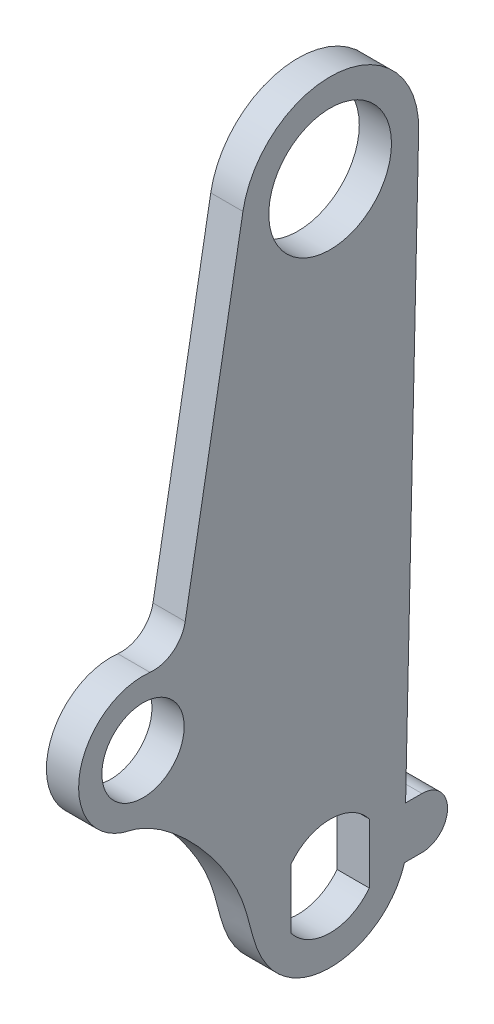
from build123d import *

# Parameters (mm, degrees)
SKETCH1_R           = 4.8387
SKETCH1_R_2         = 3.24612
BOSS_EXTRUDE1_DEPTH = 2.54


with BuildPart() as part:
    # Sketch1 → Boss-Extrude1 (new body)
    with BuildSketch(Plane(origin=(0, 0, 0), x_dir=(0, 0, -1), z_dir=(1, 0, 0))):
        with BuildLine():
            Line((-6.878073538, 1.21750951), (-11.434004928, -24.520302697))
            ThreePointArc((-11.434004928, -24.520302697), (-12.410981202, -26.109465927), (-14.210062649, -26.602647798))
            ThreePointArc((-14.210062649, -26.602647798), (-19.774345123, -30.839061635), (-15.835302692, -36.617676206))
            add(Edge.make_bspline(
                [(-15.835302692, -36.617676206), (-12.794390215, -37.276318003), (-7.085234202, -43.306604459), (-4.978743357, -56.012577764), (4.31920781, -54.832062568), (5.860778025, -49.6443)],
                knots=[0, 0, 0, 0, 0.291844795, 0.391844795, 1, 1, 1, 1], degree=3))
            Line((5.860778025, -49.6443), (7.24445656, -49.6443))
            ThreePointArc((7.24445656, -49.6443), (9.26375656, -47.625), (7.24445656, -45.6057))
            Line((7.24445656, -45.6057), (5.952380451, -45.6057))
            Line((5.952380451, -45.6057), (6.983203939, -0.158391131))
            ThreePointArc((6.983203939, -0.158391131), (0.68995561, 6.950840687), (-6.878073538, 1.21750951))
        make_face()
        Circle(SKETCH1_R, mode=Mode.SUBTRACT)
        with Locations((-14.759942791, -31.652799462)):
            Circle(SKETCH1_R_2, mode=Mode.SUBTRACT)
        with BuildLine():
            Line((3.0861, -45.263107278), (3.0861, -49.986892722))
            ThreePointArc((3.0861, -49.986892722), (0, -51.5112), (-3.0861, -49.986892722))
            Line((-3.0861, -49.986892722), (-3.0861, -45.263107278))
            ThreePointArc((-3.0861, -45.263107278), (0, -43.7388), (3.0861, -45.263107278))
        make_face(mode=Mode.SUBTRACT)
    extrude(amount=BOSS_EXTRUDE1_DEPTH)


solid = part.part
